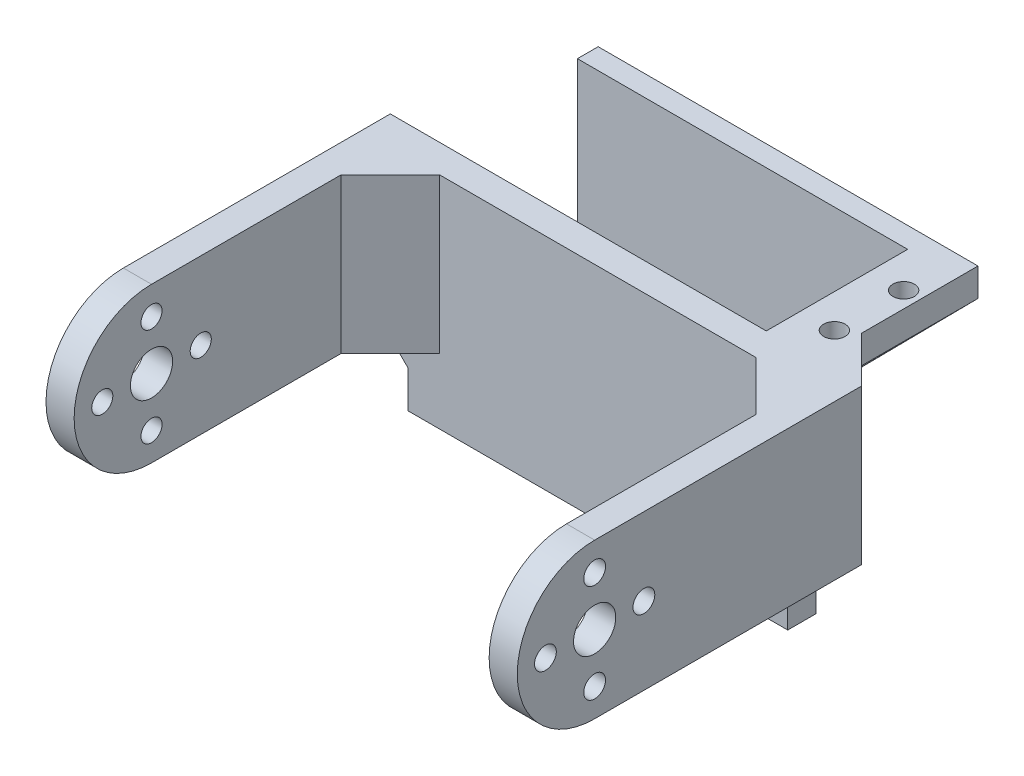
from build123d import *

# Parameters (mm, degrees)
BOSS_EXTRUDE1_DEPTH      = 22
SKETCH3_R                = 1.55
CUT_EXTRUDE1_DEPTH       = 30
CUT_EXTRUDE5_DEPTH       = 9
SKETCH11_R               = 1.55
CUT_EXTRUDE10_DEPTH      = 13
CUT_EXTRUDE11_START      = -10
CUT_EXTRUDE11_DEPTH      = 10
SKETCH13_R               = 3
SKETCH13_R_2             = 1.5
CUT_EXTRUDE12_DEPTH      = 72
FILLET1_SIZE             = 7
SKETCH14_W               = 54
SKETCH14_H               = 9.3
SKETCH14_W_2             = 7.05
SKETCH14_H_2             = 4
BOSS_EXTRUDE4_DEPTH      = 4
SKETCH17_W               = 7.05
SKETCH17_H               = 4
BOSS_EXTRUDE5_DEPTH      = 23.05
BOSS_EXTRUDE6_DEPTH      = 27.3
BOSS_EXTRUDE6_DEPTH_BACK = 4
SKETCH18_W               = 54
SKETCH18_H               = 2.95
SKETCH19_W               = 54
SKETCH19_H               = 2.8
BOSS_EXTRUDE7_DEPTH      = 21
FILLET2_SIZE             = 6.5
SKETCH20_R               = 2.625
BOSS_EXTRUDE8_DEPTH      = 6
FILLET4_R                = 1
CUT_EXTRUDE15_DEPTH      = 23.05
SKETCH23_W               = 18.360798368
SKETCH23_H               = 20.1
CUT_EXTRUDE16_DEPTH      = 23
FILLET7_SIZE             = 4
SKETCH26_R               = 1.525
CUT_EXTRUDE18_DEPTH      = 11.5


with BuildPart() as part:
    # Sketch1 → Boss-Extrude1 (new body)
    with BuildSketch(Plane(origin=(0, 0, 0), x_dir=(1, 0, 0), z_dir=(0, 1, 0))):
        Polygon((0, 0), (0, 50), (67, 50), (67, 0), (63, 0), (63, 46), (4, 46), (4, 0), align=None)
    extrude(amount=BOSS_EXTRUDE1_DEPTH)

    # Sketch3 → Cut-Extrude1 (cut)
    with BuildSketch(Plane(origin=(67, 0, 0), x_dir=(0, 0, -1), z_dir=(1, 0, 0))):
        with Locations((12.05, 11)):
            Circle(SKETCH3_R)
    extrude(amount=-CUT_EXTRUDE1_DEPTH, mode=Mode.SUBTRACT)

    # Sketch5 → Cut-Extrude5 (cut)
    with BuildSketch(Plane(origin=(67, 0, 0), x_dir=(0, 0, -1), z_dir=(1, 0, 0))):
        with BuildLine():
            Line((12.05, 22), (0, 22))
            Line((0, 22), (0, 0))
            Line((0, 0), (12.05, 0))
            ThreePointArc((12.05, 0), (1.05, 11), (12.05, 22))
        make_face()
    extrude(amount=-CUT_EXTRUDE5_DEPTH, mode=Mode.SUBTRACT)

    # Sketch11 → Cut-Extrude10 (cut)
    with BuildSketch(Plane(origin=(67, 0, 0), x_dir=(0, 0, -1), z_dir=(1, 0, 0))):
        with Locations((19.05, 11)):
            Circle(SKETCH11_R)
        with Locations((12.05, 18)):
            Circle(SKETCH11_R)
        with Locations((12.05, 4)):
            Circle(SKETCH11_R)
        with Locations((5.05, 11)):
            Circle(SKETCH11_R)
    extrude(amount=-CUT_EXTRUDE10_DEPTH, mode=Mode.SUBTRACT)

    # Sketch12 → Cut-Extrude11 (cut)
    with BuildSketch(Plane.ZY.offset(CUT_EXTRUDE11_START)):
        with BuildLine():
            Line((-12.05, 22), (0, 22))
            Line((0, 22), (0, 0))
            Line((0, 0), (-12.05, 0))
            ThreePointArc((-12.05, 0), (-1.05, 11), (-12.05, 22))
        make_face()
    extrude(amount=CUT_EXTRUDE11_DEPTH, mode=Mode.SUBTRACT)

    # Sketch13 → Cut-Extrude12 (cut)
    with BuildSketch(Plane.ZY):
        with Locations((-12.05, 11)):
            Circle(SKETCH13_R)
        with Locations((-19.05, 11)):
            Circle(SKETCH13_R_2)
        with Locations((-12.05, 4)):
            Circle(SKETCH13_R_2)
        with Locations((-5.05, 11)):
            Circle(SKETCH13_R_2)
        with Locations((-12.05, 18)):
            Circle(SKETCH13_R_2)
    extrude(amount=-CUT_EXTRUDE12_DEPTH, mode=Mode.SUBTRACT)

    # Fillet1
    fillet1_edges = [part.edges().sort_by_distance(p)[0] for p in [
        (63, 11, -46),
        (4, 11, -46),
    ]]
    chamfer(fillet1_edges, length=FILLET1_SIZE)

    # Sketch14 → Boss-Extrude4 (add)
    with BuildSketch(Plane(origin=(0, 0, -50), x_dir=(-1, 0, 0), z_dir=(0, 0, -1))):
        with Locations((-33.5, -4.65)):
            Rectangle(SKETCH14_W, SKETCH14_H)
        with Locations((-56.975, 20)):
            Rectangle(SKETCH14_W_2, SKETCH14_H_2)
        with Locations((-10.025, 20)):
            Rectangle(SKETCH14_W_2, SKETCH14_H_2)
    extrude(amount=-BOSS_EXTRUDE4_DEPTH)

    # Sketch17 → Boss-Extrude5 (add)
    with BuildSketch(Plane(origin=(0, 0, -50), x_dir=(-1, 0, 0), z_dir=(0, 0, -1))):
        with Locations((-56.975, 20)):
            Rectangle(SKETCH17_W, SKETCH17_H)
        with Locations((-10.025, 20)):
            Rectangle(SKETCH17_W, SKETCH17_H)
    extrude(amount=BOSS_EXTRUDE5_DEPTH)

    # Sketch18 → Boss-Extrude6 (add, two sides: drawn at the far end of the back side and taken through both)
    with BuildSketch(Plane.XZ.offset(-18).offset(-BOSS_EXTRUDE6_DEPTH_BACK)):
        with Locations((33.5, -71.575)):
            Rectangle(SKETCH18_W, SKETCH18_H)
    extrude(amount=BOSS_EXTRUDE6_DEPTH + BOSS_EXTRUDE6_DEPTH_BACK)

    # Sketch19 → Boss-Extrude7 (add)
    with BuildSketch(Plane(origin=(0, 0, -50), x_dir=(-1, 0, 0), z_dir=(0, 0, -1))):
        with Locations((-33.5, -7.9)):
            Rectangle(SKETCH19_W, SKETCH19_H)
    extrude(amount=BOSS_EXTRUDE7_DEPTH)

    # Fillet2
    fillet2_edges = [part.edges().sort_by_distance(p)[0] for p in [
        (60.5, 20, -50),
        (6.5, 20, -50),
    ]]
    chamfer(fillet2_edges, length=FILLET2_SIZE - 0.0001)  # a hair under: the kernel refuses the full size

    # Sketch20 → Boss-Extrude8 (add)
    with BuildSketch(Plane.XZ.offset(9.3)):
        with Locations(Location((23.4, -59.65, 0), (0, 0, 270))):
            Circle(SKETCH20_R)
    extrude(amount=BOSS_EXTRUDE8_DEPTH)

    # Fillet4
    fillet4_edges = [part.edges().sort_by_distance(p)[0] for p in [
        (23.4, -15.3, -57.025),
    ]]
    fillet(fillet4_edges, radius=FILLET4_R)

    # Sketch22 → Cut-Extrude15 (cut)
    with BuildSketch(Plane(origin=(0, 0, -73.05), x_dir=(-1, 0, 0), z_dir=(0, 0, -1))):
        Polygon((-60.5, -9.3), (-33.5, -9.3), (-60.5, 18), align=None)
    extrude(amount=-CUT_EXTRUDE15_DEPTH, mode=Mode.SUBTRACT)

    # Sketch23 → Cut-Extrude16 (cut)
    with BuildSketch(Plane(origin=(0, 22, 0), x_dir=(1, 0, 0), z_dir=(0, 1, 0))):
        with Locations((4.369600816, 60.05)):
            Rectangle(SKETCH23_W, SKETCH23_H)
    extrude(amount=-CUT_EXTRUDE16_DEPTH, mode=Mode.SUBTRACT)

    # Fillet7
    fillet7_edges = [part.edges().sort_by_distance(p)[0] for p in [
        (6.5, 0, -48),
    ]]
    chamfer(fillet7_edges, length=FILLET7_SIZE)

    # Sketch26 → Cut-Extrude18 (cut)
    with BuildSketch(Plane(origin=(0, 22, 0), x_dir=(1, 0, 0), z_dir=(0, 1, 0))):
        with Locations(Location((58.21, 64.77, 0), (0, 0, 270))):
            Circle(SKETCH26_R)
        with Locations(Location((58.21, 54.92, 0), (0, 0, 270))):
            Circle(SKETCH26_R)
    extrude(amount=-CUT_EXTRUDE18_DEPTH, mode=Mode.SUBTRACT)


solid = part.part
